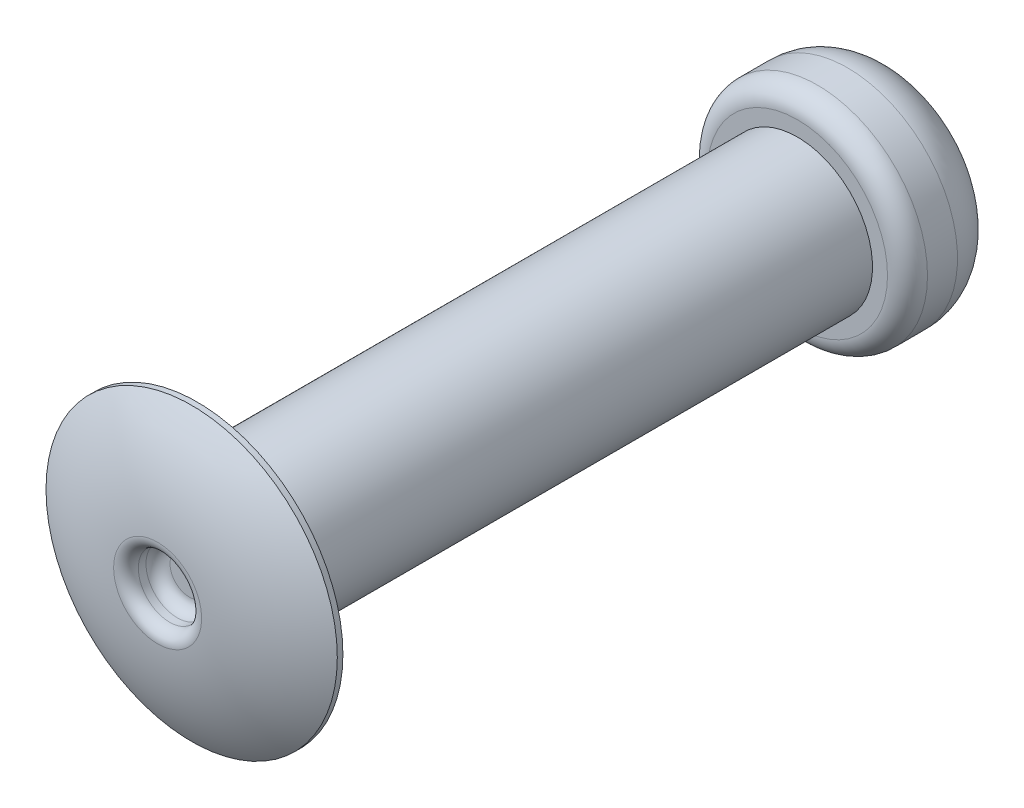
from build123d import *
from OCP.BRepFilletAPI import BRepFilletAPI_MakeFillet

# Parameters (mm, degrees)
SKETCH4_R          = 0.9921875
CUT_EXTRUDE1_DEPTH = 1.016
CUT_EXTRUDE2_START = -2.54
SKETCH3_R          = 0.9921875
CUT_EXTRUDE2_DEPTH = 2.54
FILLET1_R1         = 0.635
FILLET1_R2         = 1.5875
FILLET1_R3         = 0.381


with BuildPart() as part:
    # Sketch2 → Revolve1 (revolve)
    with BuildSketch(Plane(origin=(0, 0, 0), x_dir=(0, 0, -1), z_dir=(1, 0, 0))):
        with BuildLine():
            Line((-1.27, 0.9921875), (-1.27, 0))
            Line((-1.27, 0), (19.05, 0))
            Line((19.05, 0), (22.225, 0))
            Line((22.225, 0), (22.225, 3.4925))
            Line((22.225, 3.4925), (19.05, 3.4925))
            Line((19.05, 3.4925), (19.05, 2.38125))
            Line((19.05, 2.38125), (0, 2.38125))
            Line((0, 2.38125), (0, 4.6228))
            Line((0, 4.6228), (-0.1778, 4.6228))
            ThreePointArc((-0.1778, 4.6228), (-0.991036966, 2.887856773), (-1.27, 0.9921875))
        make_face()
    revolve(axis=Axis((0, 0, 7.600580616), (0, 0, 1)))

    # Sketch4 → Cut-Extrude1 (cut)
    with BuildSketch(Plane.XY.offset(1.27)):
        Circle(SKETCH4_R)
    extrude(amount=-CUT_EXTRUDE1_DEPTH, mode=Mode.SUBTRACT)

    # Sketch3 → Cut-Extrude2 (cut)
    with BuildSketch(Plane(origin=(0, 0, -22.225), x_dir=(-1, 0, 0), z_dir=(0, 0, -1)).offset(CUT_EXTRUDE2_START)):
        Circle(SKETCH3_R)
    extrude(amount=CUT_EXTRUDE2_DEPTH, mode=Mode.SUBTRACT)

    # Fillet1: one fillet with a radius per group of edges: ONE call of the kernel's fillet builder (fillet() takes one radius for all edges)
    fillet1_edges_1 = [part.edges().sort_by_distance(p)[0] for p in [
        (0, -3.4925, -19.05),
    ]]
    fillet1_edges_2 = [part.edges().sort_by_distance(p)[0] for p in [
        (0, -3.4925, -22.225),
    ]]
    fillet1_edges_3 = [part.edges().sort_by_distance(p)[0] for p in [
        (0, -2.38125, 0),
        (-0.701582509, -0.701582509, 1.27),
        (-0.9921875, 0, 0.254),
    ]]
    fillet1 = BRepFilletAPI_MakeFillet(part.part.solid().wrapped)
    for e in fillet1_edges_1:
        fillet1.Add(FILLET1_R1, e.wrapped)
    for e in fillet1_edges_2:
        fillet1.Add(FILLET1_R2, e.wrapped)
    for e in fillet1_edges_3:
        fillet1.Add(FILLET1_R3, e.wrapped)
    add(Compound.cast(fillet1.Shape()), mode=Mode.REPLACE)


solid = part.part
